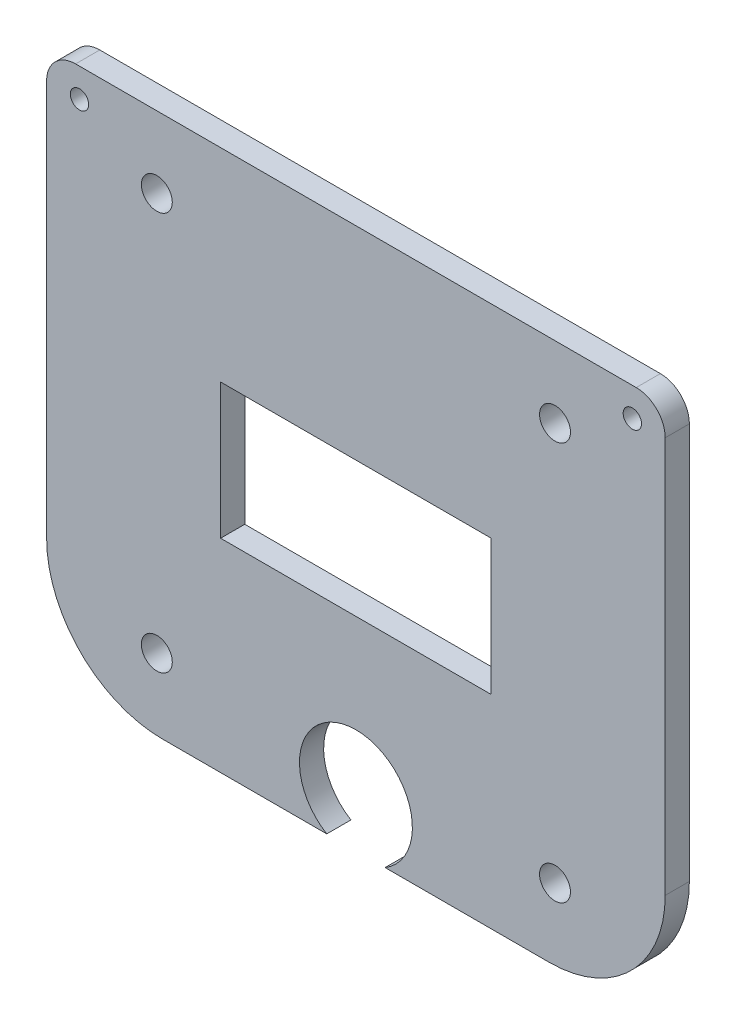
from build123d import *

# Parameters (mm, degrees)
SKETCH1_R           = 1.016
SKETCH1_R_2         = 0.60325
SKETCH1_W           = 17.78
SKETCH1_H           = 8.89
BOSS_EXTRUDE1_DEPTH = 1.5875


with BuildPart() as part:
    # Sketch1 → Boss-Extrude1 (new body)
    with BuildSketch(Plane.XY):
        with BuildLine():
            ThreePointArc((20.32, 15.875), (19.762038418, 17.222038418), (18.415, 17.78))
            Line((18.415, 17.78), (-18.415, 17.78))
            ThreePointArc((-18.415, 17.78), (-19.762038418, 17.222038418), (-20.32, 15.875))
            Line((-20.32, 15.875), (-20.32, -10.16))
            ThreePointArc((-20.32, -10.16), (-18.088153673, -15.548153673), (-12.7, -17.78))
            Line((-12.7, -17.78), (-1.916143408, -17.78))
            ThreePointArc((-1.916143408, -17.78), (-1.822965214, -11.375599376), (3.7084, -14.605))
            ThreePointArc((3.7084, -14.605), (3.229400624, -16.427965214), (1.916143408, -17.78))
            Line((1.916143408, -17.78), (12.7, -17.78))
            ThreePointArc((12.7, -17.78), (18.088153673, -15.548153673), (20.32, -10.16))
            Line((20.32, -10.16), (20.32, 15.875))
        make_face()
        with Locations((-13.08, -13.08)):
            Circle(SKETCH1_R, mode=Mode.SUBTRACT)
        with Locations((13.08, -13.08)):
            Circle(SKETCH1_R, mode=Mode.SUBTRACT)
        with Locations((-13.08, 13.08)):
            Circle(SKETCH1_R, mode=Mode.SUBTRACT)
        with Locations((-18.159675643, 15.889716188)):
            Circle(SKETCH1_R_2, mode=Mode.SUBTRACT)
        Rectangle(SKETCH1_W, SKETCH1_H, mode=Mode.SUBTRACT)
        with Locations((13.08, 13.08)):
            Circle(SKETCH1_R, mode=Mode.SUBTRACT)
        with Locations((18.159675643, 15.889716188)):
            Circle(SKETCH1_R_2, mode=Mode.SUBTRACT)
    extrude(amount=BOSS_EXTRUDE1_DEPTH)


solid = part.part
